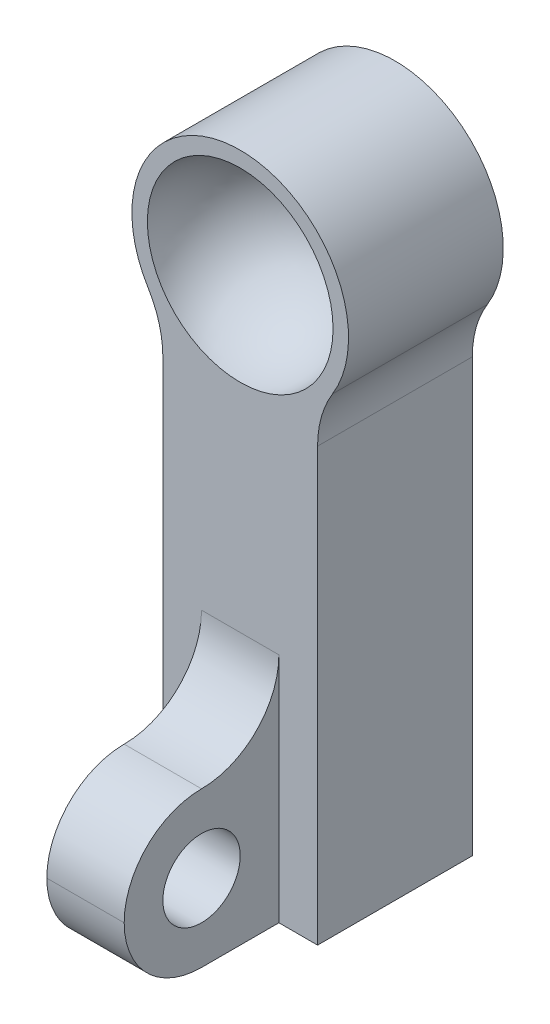
from build123d import *

# Parameters (mm, degrees)
AUFSATZ_LINEAR_AUSTRAGEN1_DEPTH      = 5
AUFSATZ_LINEAR_AUSTRAGEN2_DEPTH      = 1.25
AUFSATZ_LINEAR_AUSTRAGEN2_DEPTH_BACK = 1.25
SKIZZE2_W                            = 5
SKIZZE2_H                            = 5
SKIZZE3_R                            = 1.25
SCHNITT_LINEAR_AUSTRAGEN1_DEPTH      = 3.25
M3_GEWINDEBOHRUNG1_D                 = 2.5
M3_GEWINDEBOHRUNG1_DEPTH             = 8.5
M3_GEWINDEBOHRUNG1_TIP               = 0.751075774
VERRUNDUNG1_R                        = 2.5


with BuildPart() as part:
    # Skizze1 → Aufsatz-Linear austragen1 (new body)
    with BuildSketch(Plane.XY):
        with BuildLine():
            Line((-2.5, -3.535533906), (-2.5, -17.5))
            Line((-2.5, -17.5), (2.5, -17.5))
            Line((2.5, -17.5), (2.5, -3.535533906))
            ThreePointArc((2.5, -3.535533906), (2.622686042, -2.650995943), (2.981481481, -1.833239803))
            ThreePointArc((2.981481481, -1.833239803), (0, 3.5), (-2.981481481, -1.833239803))
            ThreePointArc((-2.981481481, -1.833239803), (-2.622686042, -2.650995943), (-2.5, -3.535533906))
        make_face()
    extrude(amount=AUFSATZ_LINEAR_AUSTRAGEN1_DEPTH)

    # Skizze2 → Aufsatz-Linear austragen2 (add, two sides: drawn at the far end of the back side and taken through both)
    with BuildSketch(Plane(origin=(0, 0, 0), x_dir=(0, 0, -1), z_dir=(1, 0, 0)).offset(-AUFSATZ_LINEAR_AUSTRAGEN2_DEPTH_BACK)):
        with Locations((-7.5, -15)):
            Rectangle(SKIZZE2_W, SKIZZE2_H)
    extrude(amount=AUFSATZ_LINEAR_AUSTRAGEN2_DEPTH + AUFSATZ_LINEAR_AUSTRAGEN2_DEPTH_BACK)

    # Skizze3 → Schnitt-Linear austragen1 (cut)
    with BuildSketch(Plane(origin=(1.25, 0, 0), x_dir=(0, 0, -1), z_dir=(1, 0, 0))):
        with Locations((-7.5, -15)):
            Circle(SKIZZE3_R)
    extrude(amount=-SCHNITT_LINEAR_AUSTRAGEN1_DEPTH, mode=Mode.SUBTRACT)

    # Skizze4 → Schnitt-Rotation1 (revolve, cut)
    with BuildSketch(Plane(origin=(0, 0, 0), x_dir=(1, 0, 0), z_dir=(0, 1, 0))):
        with BuildLine():
            Line((3, -5), (-3, -5))
            ThreePointArc((-3, -5), (0, -2), (3, -5))
        make_face()
    revolve(axis=Axis((7.725672482, 0, 5), (-1, 0, 0)), mode=Mode.SUBTRACT)

    # M3 Gewindebohrung1
    with Locations(Plane(origin=(0, -17.5, 2.5), x_dir=(0, 0, -1), z_dir=(0, -1, 0))):
        with Locations((0, 0)):
            Hole(M3_GEWINDEBOHRUNG1_D / 2, depth=M3_GEWINDEBOHRUNG1_DEPTH)
            with Locations((0, 0, -(M3_GEWINDEBOHRUNG1_DEPTH + M3_GEWINDEBOHRUNG1_TIP / 2))):  # 118° drill point
                Cone(0, M3_GEWINDEBOHRUNG1_D / 2, M3_GEWINDEBOHRUNG1_TIP, mode=Mode.SUBTRACT)

    # Verrundung1
    verrundung1_edges = [part.edges().sort_by_distance(p)[0] for p in [
        (0, -12.5, 5),
        (0, -12.5, 10),
        (0, -17.5, 10),
    ]]
    fillet(verrundung1_edges, radius=VERRUNDUNG1_R - 0.0001)  # a hair under: the kernel refuses the full size


solid = part.part
